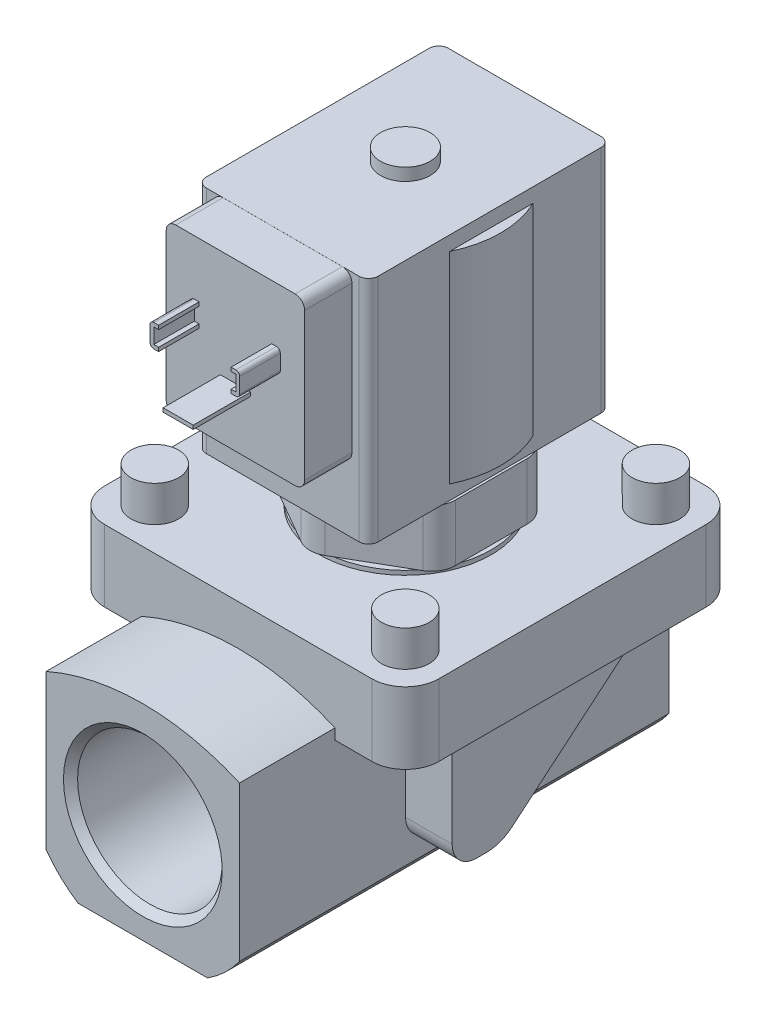
from build123d import *

# Parameters (mm, degrees)
IZIM1_W                      = 50.7
IZIM1_H                      = 48.2
Y_KSEKLIK_EKSTR_ZYON1_DEPTH  = 26.7
IZIM2_R                      = 8.7
Y_KSEKLIK_EKSTR_ZYON2_DEPTH  = 0.5
Y_KSEKLIK_EKSTR_ZYON3_DEPTH  = 11.9
IZIM4_R                      = 16.5
Y_KSEKLIK_EKSTR_ZYON4_DEPTH  = 0.9
IZIM5_R                      = 18
Y_KSEKLIK_EKSTR_ZYON5_DEPTH  = 0.9
Y_KSEKLIK_EKSTR_ZYON6_DEPTH  = 36
Y_KSEKLIK_EKSTR_ZYON7_DEPTH  = 17
Y_KSEKLIK_EKSTR_ZYON8_START  = 17
Y_KSEKLIK_EKSTR_ZYON8_DEPTH  = 17
IZIM9_W                      = 14.75
IZIM9_H                      = 70
KES_EKSTR_ZYON1_DEPTH        = 30.160746911
IZIM10_W                     = 14.75
IZIM10_H                     = 70
KES_EKSTR_ZYON2_DEPTH        = 30.160746911
IZIM11_W                     = 50.7
IZIM11_H                     = 48.2
Y_KSEKLIK_EKSTR_ZYON9_DEPTH  = 9.3
Y_KSEKLIK_EKSTR_ZYON10_START = 20
Y_KSEKLIK_EKSTR_ZYON10_DEPTH = 20
IZIM13_W                     = 9.75
IZIM13_H                     = 10.2
Y_KSEKLIK_EKSTR_ZYON11_DEPTH = 26.5
Y_KSEKLIK_EKSTR_ZYON12_DEPTH = 42.2
Y_KSEKLIK_EKSTR_ZYON13_START = -42.2
Y_KSEKLIK_EKSTR_ZYON13_DEPTH = 42.2
IZIM16_W                     = 29
IZIM16_H                     = 34.79
Y_KSEKLIK_EKSTR_ZYON14_DEPTH = 9.9
Y_KSEKLIK_EKSTR_ZYON15_DEPTH = 8.5
Y_KSEKLIK_EKSTR_ZYON16_DEPTH = 8.5
IZIM19_W                     = 6.3
IZIM19_H                     = 0.8
Y_KSEKLIK_EKSTR_ZYON17_DEPTH = 12
DRAFT1_ANGLE                 = 50
IZIM20_W                     = 5
IZIM20_H                     = 7.5
IZIM21_W                     = 5
IZIM21_H                     = 7.5
IZIM22_W                     = 5
IZIM22_H                     = 7.5
IZIM23_W                     = 5
IZIM23_H                     = 7.5
IZIM24_W                     = 5.2
IZIM24_H                     = 2.6
M27_BO_LUKLU_DELIK1_D        = 30.291
M27_BO_LUKLU_DELIK1_DEPTH    = 33.249
M27_BO_LUKLU_DELIK2_D        = 30.291
M27_BO_LUKLU_DELIK2_DEPTH    = 33.249
FEDER1_START                 = -30
FEDER1_DEPTH                 = 9.75
PAH1_SIZE                    = 1.479
RADYUS1_R                    = 0.8
RADYUS2_R                    = 2
RADYUS3_R                    = 5
RADYUS4_R                    = 5.1
RADYUS5_R                    = 7
RADYUS6_R                    = 8.16
L_EK1_SCALE                  = 0.46


# Read off the part's stored shape, not the designer's step: Feder1
with BuildPart() as part:
    # Çizim1 → Yükseklik-Ekstrüzyon1 (new body)
    with BuildSketch(Plane(origin=(18, 0, 0), x_dir=(0, 0, -1), z_dir=(1, 0, 0))):
        with Locations((-0.35, 68.8)):
            Rectangle(IZIM1_W, IZIM1_H)
    extrude(amount=-Y_KSEKLIK_EKSTR_ZYON1_DEPTH)

    # Çizim2 → Yükseklik-Ekstrüzyon2 (add)
    with BuildSketch(Plane.XZ.offset(-44.7)):
        with Locations(Location((0, 0, 0), (0, 0, 180))):
            Circle(IZIM2_R)
    extrude(amount=Y_KSEKLIK_EKSTR_ZYON2_DEPTH)

    # Çizim3 → Yükseklik-Ekstrüzyon3 (add)
    with BuildSketch(Plane(origin=(0, 44.2, 0), x_dir=(1, 0, 0), z_dir=(0, 1, 0))):
        Polygon((-18, 10.392304845), (-18, -10.392304845), (0, -20.784609691), (18, -10.392304845), (18, 10.392304845), (0, 20.784609691), align=None)
    extrude(amount=-Y_KSEKLIK_EKSTR_ZYON3_DEPTH)

    # Çizim4 → Yükseklik-Ekstrüzyon4 (add)
    with BuildSketch(Plane.XZ.offset(-32.3)):
        with Locations(Location((0, 0, 0), (0, 0, 270))):
            Circle(IZIM4_R)
    extrude(amount=Y_KSEKLIK_EKSTR_ZYON4_DEPTH)

    # Çizim5 → Yükseklik-Ekstrüzyon5 (add)
    with BuildSketch(Plane(origin=(0, 31.4, 0), x_dir=(1, 0, 0), z_dir=(0, 1, 0))):
        with Locations(Location((0, 0, 0), (0, 0, 90))):
            Circle(IZIM5_R)
    extrude(amount=-Y_KSEKLIK_EKSTR_ZYON5_DEPTH)

    # Çizim6 → Yükseklik-Ekstrüzyon6 (add)
    with BuildSketch(Plane.XY.offset(18)):
        with BuildLine():
            Line((-13.564659966, -21), (13.564659966, -21))
            ThreePointArc((13.564659966, -21), (17.201870235, -18.14099392), (20.25, -14.660746911))
            Line((20.25, -14.660746911), (35, -14.660746911))
            Line((35, -14.660746911), (35, 30.5))
            Line((35, 30.5), (0, 30.5))
            Line((0, 30.5), (-35, 30.5))
            Line((-35, 30.5), (-35, -14.660746911))
            Line((-35, -14.660746911), (-20.25, -14.660746911))
            ThreePointArc((-20.25, -14.660746911), (-17.201870235, -18.14099392), (-13.564659966, -21))
        make_face()
    extrude(amount=-Y_KSEKLIK_EKSTR_ZYON6_DEPTH)

    # Çizim7 → Yükseklik-Ekstrüzyon7 (add)
    with BuildSketch(Plane(origin=(0, 0, -18), x_dir=(-1, 0, 0), z_dir=(0, 0, -1))):
        with BuildLine():
            Line((13.564659966, -21), (-13.564659966, -21))
            ThreePointArc((-13.564659966, -21), (-17.201870235, -18.14099392), (-20.25, -14.660746911))
            Line((-20.25, -14.660746911), (-35, -14.660746911))
            Line((-35, -14.660746911), (-35, 30.5))
            Line((-35, 30.5), (35, 30.5))
            Line((35, 30.5), (35, -14.660746911))
            Line((35, -14.660746911), (20.25, -14.660746911))
            ThreePointArc((20.25, -14.660746911), (17.201870235, -18.14099392), (13.564659966, -21))
        make_face()
    extrude(amount=Y_KSEKLIK_EKSTR_ZYON7_DEPTH)

    # Çizim8 → Yükseklik-Ekstrüzyon8 (add)
    with BuildSketch(Plane.XY.offset(18).offset(Y_KSEKLIK_EKSTR_ZYON8_START)):
        with BuildLine():
            Line((13.564659966, -21), (-13.564659966, -21))
            ThreePointArc((-13.564659966, -21), (-17.201870235, -18.14099392), (-20.25, -14.660746911))
            Line((-20.25, -14.660746911), (-35, -14.660746911))
            Line((-35, -14.660746911), (-35, 30.5))
            Line((-35, 30.5), (35, 30.5))
            Line((35, 30.5), (35, -14.660746911))
            Line((35, -14.660746911), (20.25, -14.660746911))
            ThreePointArc((20.25, -14.660746911), (17.201870235, -18.14099392), (13.564659966, -21))
        make_face()
    extrude(amount=-Y_KSEKLIK_EKSTR_ZYON8_DEPTH)

    # Çizim9 → Kes-Ekstrüzyon1 (cut)
    with BuildSketch(Plane.XZ.offset(14.660746911)):
        with Locations((27.625, 0)):
            Rectangle(IZIM9_W, IZIM9_H)
    extrude(amount=-KES_EKSTR_ZYON1_DEPTH, mode=Mode.SUBTRACT)

    # Çizim10 → Kes-Ekstrüzyon2 (cut)
    with BuildSketch(Plane.XZ.offset(14.660746911)):
        with Locations((-27.625, 0)):
            Rectangle(IZIM10_W, IZIM10_H)
    extrude(amount=-KES_EKSTR_ZYON2_DEPTH, mode=Mode.SUBTRACT)

    # Çizim11 → Yükseklik-Ekstrüzyon9 (add)
    with BuildSketch(Plane.ZY.offset(8.7)):
        with Locations((0.35, 68.8)):
            Rectangle(IZIM11_W, IZIM11_H)
    extrude(amount=Y_KSEKLIK_EKSTR_ZYON9_DEPTH)

    # Çizim12 → Yükseklik-Ekstrüzyon10 (add)
    with BuildSketch(Plane.XY.offset(35).offset(Y_KSEKLIK_EKSTR_ZYON10_START)):
        with BuildLine():
            Line((-20.25, -14.660746911), (-20.25, 17.715834237))
            ThreePointArc((-20.25, 17.715834237), (0, 22), (20.25, 17.715834237))
            Line((20.25, 17.715834237), (20.25, -14.660746911))
            ThreePointArc((20.25, -14.660746911), (17.201870235, -18.14099392), (13.564659966, -21))
            Line((13.564659966, -21), (-13.564659966, -21))
            ThreePointArc((-13.564659966, -21), (-17.201870235, -18.14099392), (-20.25, -14.660746911))
        make_face()
    extrude(amount=-Y_KSEKLIK_EKSTR_ZYON10_DEPTH)

    # Çizim13 → Yükseklik-Ekstrüzyon11 (add)
    with BuildSketch(Plane.XZ.offset(-15.5)):
        with Locations((25.125, 15.1)):
            Rectangle(IZIM13_W, IZIM13_H)
    extrude(amount=Y_KSEKLIK_EKSTR_ZYON11_DEPTH)

    # Çizim14 → Yükseklik-Ekstrüzyon12 (add)
    with BuildSketch(Plane(origin=(0, 89.9, 0), x_dir=(1, 0, 0), z_dir=(0, 1, 0))):
        with BuildLine():
            Line((-18, -8.717797887), (-18, 8.717797887))
            ThreePointArc((-18, 8.717797887), (-20, 0), (-18, -8.717797887))
        make_face()
    extrude(amount=-Y_KSEKLIK_EKSTR_ZYON12_DEPTH)

    # Çizim15 → Yükseklik-Ekstrüzyon13 (add)
    with BuildSketch(Plane.XZ.offset(-47.7).offset(Y_KSEKLIK_EKSTR_ZYON13_START)):
        with BuildLine():
            Line((18, 8.717797887), (18, -8.717797887))
            ThreePointArc((18, -8.717797887), (20, 0), (18, 8.717797887))
        make_face()
    extrude(amount=Y_KSEKLIK_EKSTR_ZYON13_DEPTH)

    # Çizim16 → Yükseklik-Ekstrüzyon14 (add)
    with BuildSketch(Plane.XY.offset(25.7)):
        with Locations((0, 75.495)):
            Rectangle(IZIM16_W, IZIM16_H)
    extrude(amount=Y_KSEKLIK_EKSTR_ZYON14_DEPTH)

    # Çizim17 → Yükseklik-Ekstrüzyon15 (add)
    with BuildSketch(Plane.XY.offset(35.6)):
        Polygon((-9.4, 81.4), (-7.6, 81.4), (-7.6, 80.6), (-8.6, 80.6), (-8.6, 77.4), (-7.6, 77.4), (-7.6, 76.6), (-9.4, 76.6), align=None)
    extrude(amount=Y_KSEKLIK_EKSTR_ZYON15_DEPTH)

    # Çizim18 → Yükseklik-Ekstrüzyon16 (add)
    with BuildSketch(Plane.XY.offset(35.6)):
        Polygon((7.6, 77.4), (8.6, 77.4), (8.6, 80.6), (7.6, 80.6), (7.6, 81.4), (9.4, 81.4), (9.4, 76.6), (7.6, 76.6), align=None)
    extrude(amount=Y_KSEKLIK_EKSTR_ZYON16_DEPTH)

    # Çizim19 → Yükseklik-Ekstrüzyon17 (add)
    with BuildSketch(Plane.XY.offset(35.6)):
        with Locations((0, 70)):
            Rectangle(IZIM19_W, IZIM19_H)
    extrude(amount=Y_KSEKLIK_EKSTR_ZYON17_DEPTH)

    # Draft1
    draft1_faces = [part.faces().sort_by_distance(p)[0] for p in [
        (25.125, 2.25, 10),
    ]]
    draft(draft1_faces, Plane(origin=(0, -11, 0), x_dir=(0, 0, -1), z_dir=(0, -1, 0)), DRAFT1_ANGLE)

    # Çizim20 → Döndür1 (revolve)
    with BuildSketch(Plane.XY.offset(26.25), mode=Mode.PRIVATE) as d_nd_r1_sk:
        with Locations((-23.75, 34.25)):
            Rectangle(IZIM20_W, IZIM20_H)
    revolve(d_nd_r1_sk.sketch.rotate(Axis((-26.25, 38, 26.25), (0, -1, 0)), 270), axis=Axis((-26.25, 38, 26.25), (0, -1, 0)))

    # Çizim21 → Döndür2 (revolve)
    with BuildSketch(Plane.XY.offset(-26.25), mode=Mode.PRIVATE) as d_nd_r2_sk:
        with Locations((-23.75, 34.25)):
            Rectangle(IZIM21_W, IZIM21_H)
    revolve(d_nd_r2_sk.sketch.rotate(Axis((-26.25, 38, -26.25), (0, -1, 0)), 270), axis=Axis((-26.25, 38, -26.25), (0, -1, 0)))

    # Çizim22 → Döndür3 (revolve)
    with BuildSketch(Plane.XY.offset(-26.25), mode=Mode.PRIVATE) as d_nd_r3_sk:
        with Locations((28.75, 34.25)):
            Rectangle(IZIM22_W, IZIM22_H)
    revolve(d_nd_r3_sk.sketch.rotate(Axis((26.25, 38, -26.25), (0, -1, 0)), 270), axis=Axis((26.25, 38, -26.25), (0, -1, 0)))

    # Çizim23 → Döndür4 (revolve)
    with BuildSketch(Plane.XY.offset(26.25), mode=Mode.PRIVATE) as d_nd_r4_sk:
        with Locations((28.75, 34.25)):
            Rectangle(IZIM23_W, IZIM23_H)
    revolve(d_nd_r4_sk.sketch.rotate(Axis((26.25, 38, 26.25), (0, -1, 0)), 270), axis=Axis((26.25, 38, 26.25), (0, -1, 0)))

    # Çizim24 → Döndür5 (revolve)
    with BuildSketch(Plane(origin=(0, 0, 0), x_dir=(-1, 0, 0), z_dir=(0, 0, -1)), mode=Mode.PRIVATE) as d_nd_r5_sk:
        with Locations((-2.6, 94.2)):
            Rectangle(IZIM24_W, IZIM24_H)
    revolve(d_nd_r5_sk.sketch.rotate(Axis((0, 92.9, 0), (0, 1, 0)), 90), axis=Axis((0, 92.9, 0), (0, 1, 0)))

    # M27 Boşluklu Delik1
    with Locations(Plane.XY.offset(55)):
        with Locations((0, 0)):
            Hole(M27_BO_LUKLU_DELIK1_D / 2, depth=M27_BO_LUKLU_DELIK1_DEPTH)

    # M27 Boşluklu Delik2
    with Locations(Plane(origin=(0, 0, -35), x_dir=(-1, 0, 0), z_dir=(0, 0, -1))):
        with Locations((0, 0)):
            Hole(M27_BO_LUKLU_DELIK2_D / 2, depth=M27_BO_LUKLU_DELIK2_DEPTH)

    # Feder1 outline → Feder1 (add)
    with BuildSketch(Plane.YZ.offset(FEDER1_START)):
        Polygon((15.5, 19.826070485), (-9.313312955, 19.826070485), (-12.686687045, 12.591846402), (15.5, -20.999739147), align=None)
    extrude(amount=FEDER1_DEPTH)

    # Pah1
    pah1_edges = [part.edges().sort_by_distance(p)[0] for p in [
        (15.1455, 0, 55),
        (-15.1455, 0, -35),
    ]]
    chamfer(pah1_edges, length=PAH1_SIZE)

    # Radyus1
    radyus1_edges = [part.edges().sort_by_distance(p)[0] for p in [
        (-9.4, 81.4, 39.85),
        (-9.4, 76.6, 39.85),
        (9.4, 76.6, 39.85),
        (9.4, 81.4, 39.85),
    ]]
    fillet(radyus1_edges, radius=RADYUS1_R)

    # Radyus2
    radyus2_edges = [part.edges().sort_by_distance(p)[0] for p in [
        (-18, 68.8, -25),
        (-18, 68.8, 25.7),
        (-14.5, 92.89, 30.65),
        (-14.5, 58.1, 30.65),
        (14.5, 58.1, 30.65),
        (14.5, 92.89, 30.65),
        (18, 68.8, 25.7),
        (18, 68.8, -25),
    ]]
    fillet(radyus2_edges, radius=RADYUS2_R)

    # Radyus3
    radyus3_edges = [part.edges().sort_by_distance(p)[0] for p in [
        (-18, 38.25, -10.392304845),
        (0, 38.25, -20.784609691),
        (18, 38.25, -10.392304845),
        (18, 38.25, 10.392304845),
        (0, 38.25, 20.784609691),
        (-18, 38.25, 10.392304845),
    ]]
    fillet(radyus3_edges, radius=RADYUS3_R)

    # Radyus4
    radyus4_edges = [part.edges().sort_by_distance(p)[0] for p in [
        (25.125, -11, 20.2),
    ]]
    fillet(radyus4_edges, radius=RADYUS4_R)

    # Radyus5
    radyus5_edges = [part.edges().sort_by_distance(p)[0] for p in [
        (35, 23, 35),
        (-35, 23, -35),
        (35, 23, -35),
        (-35, 23, 35),
    ]]
    fillet(radyus5_edges, radius=RADYUS5_R)

    # Radyus6
    radyus6_edges = [part.edges().sort_by_distance(p)[0] for p in [
        (25.125, -11, 10),
    ]]
    fillet(radyus6_edges, radius=RADYUS6_R)


with BuildPart() as part_1:
    # Ölçek1: scaled about (0.014445195, 31.538640435, 4.897050437)
    add(part.part.scale(L_EK1_SCALE).moved(Location((0.007800405, 17.030865835, 2.644407236))))


solid = part_1.part
